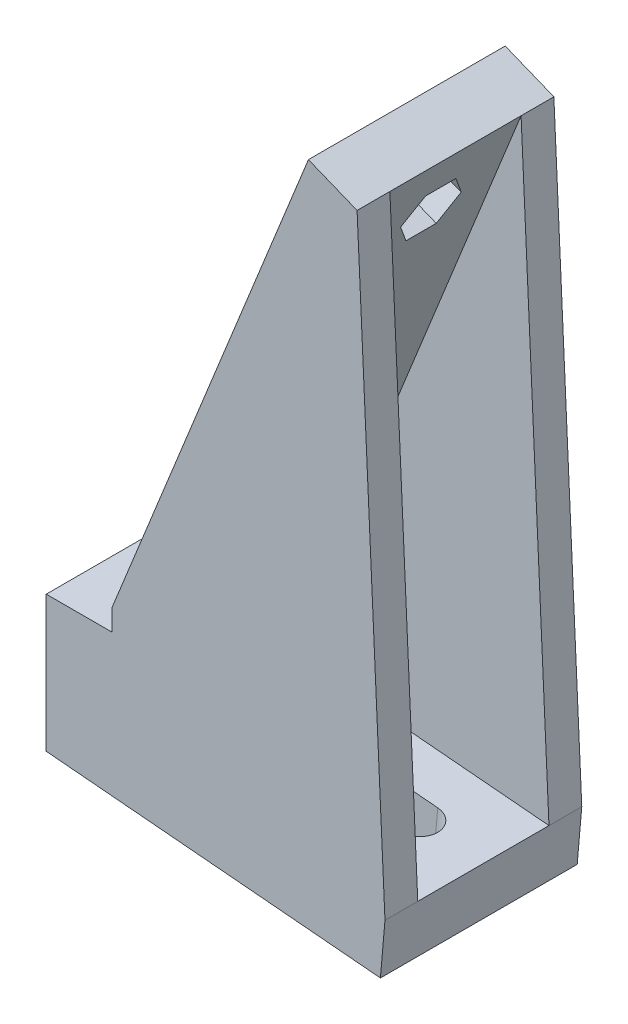
from build123d import *

# Parameters (mm, degrees)
BOSS_EXTRUDE1_DEPTH            = 15
CUT_EXTRUDE1_DEPTH             = 102.502312716
RIB1_REACH                     = 92.198
SKETCH4_WALL_W                 = 274.08141224
SKETCH4_WALL_H                 = 5
M4_CLEARANCE_HOLE1_D           = 4.5
M4_CLEARANCE_HOLE1_CSINK_D     = 4.55
M4_CLEARANCE_HOLE1_CSINK_ANGLE = 90
CUT_EXTRUDE2_DEPTH             = 3
FILLET1_R                      = 10


with BuildPart() as part:
    # Sketch1 → Boss-Extrude1 (new, symmetric)
    with BuildSketch(Plane.XY):
        Polygon((0, 0), (29.968527473, 74.174708365), (37.38599831, 71.177855618), (1.791119352, -16.922561338), (41.638907276, -20.408791048), (40.941661334, -28.378348633), (-10, -23.921530765), (-10, -3.175), (0, -3.175), align=None)
    extrude(amount=BOSS_EXTRUDE1_DEPTH, both=True)

    # Sketch2 → Cut-Extrude1 (cut, through all)
    with BuildSketch(Plane(origin=(-1.077186067, -16.671617131, 0), x_dir=(0.9961946980917449, -0.08715574274766551, 0), z_dir=(0.08715574274766551, 0.9961946980917449, 0))):
        with BuildLine():
            Line((32.87926188, -3), (27.87926188, -3))
            ThreePointArc((27.87926188, -3), (24.87926188, 0), (27.87926188, 3))
            Line((27.87926188, 3), (32.87926188, 3))
            ThreePointArc((32.87926188, 3), (35.87926188, 0), (32.87926188, -3))
        make_face()
    extrude(amount=-CUT_EXTRUDE1_DEPTH, mode=Mode.SUBTRACT)

    # Sketch4 wall → Rib1 (add, up to next)
    with BuildSketch(Plane(origin=(39.512452793, 25.384532285, 15), x_dir=(0.046385922653, -0.998923593765, 0), z_dir=(0.998923593765, 0.046385922653, 0)), mode=Mode.PRIVATE) as rib1_sk1:
        with Locations((0, 2.5)):
            Rectangle(SKETCH4_WALL_W, SKETCH4_WALL_H)
    rib1_tool1 = extrude(rib1_sk1.sketch, amount=-RIB1_REACH, mode=Mode.PRIVATE) - part.part
    rib1 = rib1_tool1.solids().sort_by_distance((39.512452793, 25.384532285, 15))[0]
    add(rib1)

    # Mirror1: Rib1 across plane
    add(rib1.mirror(Plane.XY))

    # M4 Clearance Hole1 (through all)
    with Locations(Plane(origin=(7.417470837, -2.996852747, 0), x_dir=(0, 0, -1), z_dir=(0.9271838545667858, -0.37460659341591607, 0))):
        with Locations((0, 70), (0, 25)):
            CounterSinkHole(M4_CLEARANCE_HOLE1_D / 2, M4_CLEARANCE_HOLE1_CSINK_D / 2, counter_sink_angle=M4_CLEARANCE_HOLE1_CSINK_ANGLE)

    # Sketch8 → Cut-Extrude2 (cut)
    with BuildSketch(Plane(origin=(7.417470837, -2.996852747, 0), x_dir=(0, 0, -1), z_dir=(0.9271838545667858, -0.37460659341591607, 0))):
        Polygon((4.618802154, 70), (2.309401077, 74), (-2.309401077, 74), (-4.618802154, 70), (-2.309401077, 66), (2.309401077, 66), align=None)
        Polygon((4.618802154, 25), (2.309401077, 29), (-2.309401077, 29), (-4.618802154, 25), (-2.309401077, 21), (2.309401077, 21), align=None)
    extrude(amount=-CUT_EXTRUDE2_DEPTH, mode=Mode.SUBTRACT)

    # Fillet1
    fillet1_edges = [part.edges().sort_by_distance(p)[0] for p in [
        (1.791119352, -16.922561338, 0),
    ]]
    fillet(fillet1_edges, radius=FILLET1_R)


solid = part.part
